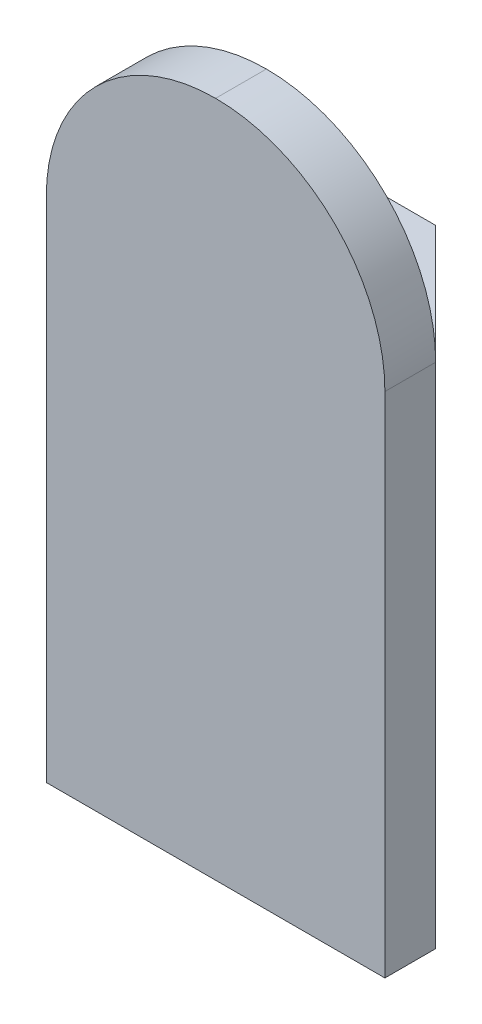
from build123d import *

# Parameters (mm, degrees)
EXTRUDE_1_DEPTH = 10
EXTRUDE_START   = -10
EXTRUDE_2_DEPTH = 3
SKETCH_2_W      = 20
SKETCH_2_H      = 3
EXTRUDE_3_DEPTH = 20
FILLET_1_R      = 10


with BuildPart() as part:
    # Эскиз1 → Бобышка-Вытянуть1 (new, symmetric)
    with BuildSketch(Plane(origin=(0, 0, 0), x_dir=(1, 0, 0), z_dir=(0, 1, 0))):
        Polygon((20, 0), (0, 0), (0, 20), (3, 20), (3, 3), (20, 3), align=None)
    extrude(amount=EXTRUDE_1_DEPTH, both=True)

    # Эскиз1<3> → Бобышка-Вытянуть2 (add)
    with BuildSketch(Plane(origin=(0, 0, 0), x_dir=(1, 0, 0), z_dir=(0, 1, 0)).offset(EXTRUDE_START)):
        Polygon((3, 20), (20, 3), (3, 3), align=None)
    extrude_2 = extrude(amount=EXTRUDE_2_DEPTH)

    # Зеркальное отражение2: Бобышка-Вытянуть2 across plane
    add(extrude_2.mirror(Plane.ZX))

    # Эскиз2 → Бобышка-Вытянуть3 (add)
    with BuildSketch(Plane(origin=(0, 10, 0), x_dir=(1, 0, 0), z_dir=(0, 1, 0))):
        with Locations((10, 1.5)):
            Rectangle(SKETCH_2_W, SKETCH_2_H)
    extrude(amount=EXTRUDE_3_DEPTH)

    # Скругление1
    fillet_1_edges = [part.edges().sort_by_distance(p)[0] for p in [
        (0, 30, -1.5),
        (20, 30, -1.5),
    ]]
    fillet(fillet_1_edges, radius=FILLET_1_R - 0.0001)  # a hair under: the kernel refuses the full size


solid = part.part
